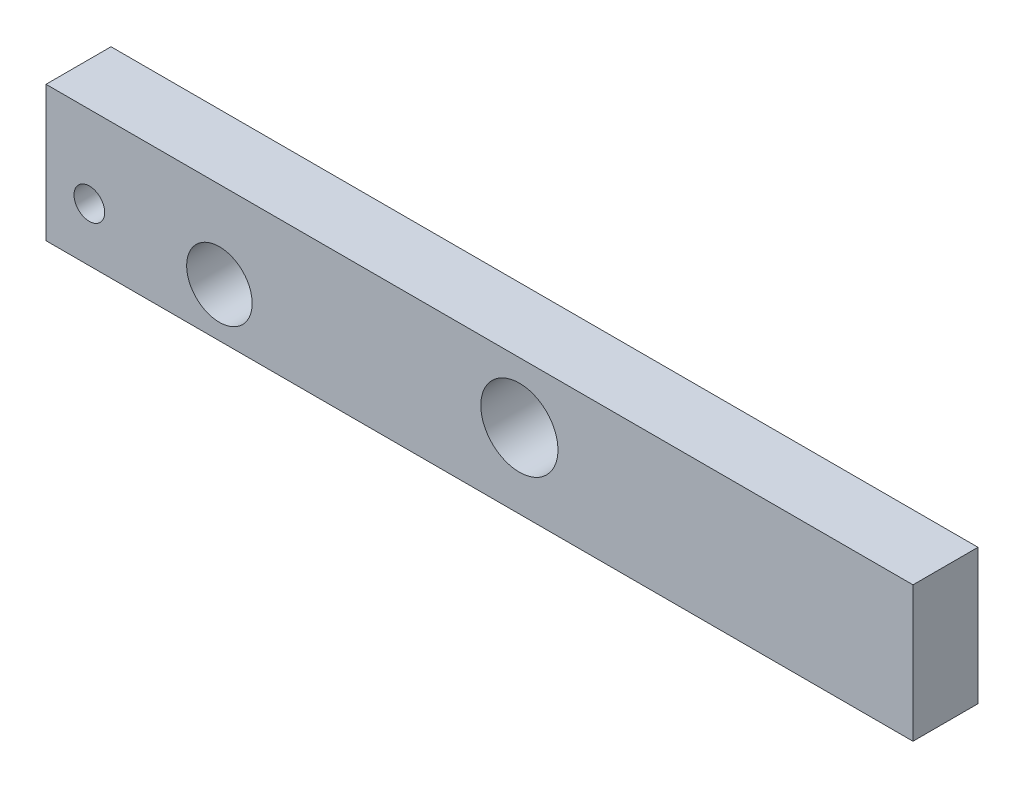
from build123d import *

# Parameters (mm, degrees)
SKETCH1_W           = 127
SKETCH1_H           = 44.45
BOSS_EXTRUDE1_DEPTH = 9.525
SKETCH6_R           = 4.8
CUT_EXTRUDE1_DEPTH  = 68.947967225
SKETCH10_R          = 2.286
CUT_EXTRUDE2_DEPTH  = 3.81
SKETCH13_W          = 127
SKETCH13_H          = 49.203053771
CUT_EXTRUDE3_DEPTH  = 68.947967225
SKETCH15_R          = 5.652121823
CUT_EXTRUDE4_DEPTH  = 68.947967225
SKETCH16_R          = 2.2479
CUT_EXTRUDE5_DEPTH  = 68.947967225


with BuildPart() as part:
    # Sketch1 → Boss-Extrude1 (new body)
    with BuildSketch(Plane.XY):
        Rectangle(SKETCH1_W, SKETCH1_H)
    extrude(amount=BOSS_EXTRUDE1_DEPTH)

    # Sketch6 → Cut-Extrude1 (cut, through all)
    with BuildSketch(Plane.XY):
        with Locations((-38.1, 9.525)):
            Circle(SKETCH6_R)
    extrude(amount=CUT_EXTRUDE1_DEPTH, mode=Mode.SUBTRACT)

    # Sketch10 → Cut-Extrude2 (cut)
    with BuildSketch(Plane.XY.offset(9.525)):
        with Locations((-46.11545283, -16.764)):
            Circle(SKETCH10_R)
    extrude(amount=-CUT_EXTRUDE2_DEPTH, mode=Mode.SUBTRACT)

    # Sketch13 → Cut-Extrude3 (cut, through all)
    with BuildSketch(Plane(origin=(0, 0, 0), x_dir=(-1, 0, 0), z_dir=(0, 0, -1))):
        with Locations((0, -22.225000001)):
            Rectangle(SKETCH13_W, SKETCH13_H)
    extrude(amount=-CUT_EXTRUDE3_DEPTH, mode=Mode.SUBTRACT)

    # Sketch15 → Cut-Extrude4 (cut, through all)
    with BuildSketch(Plane(origin=(0, 0, 0), x_dir=(-1, 0, 0), z_dir=(0, 0, -1))):
        with Locations((-5.842, 13.335)):
            Circle(SKETCH15_R)
    extrude(amount=-CUT_EXTRUDE4_DEPTH, mode=Mode.SUBTRACT)

    # Sketch16 → Cut-Extrude5 (cut, through all)
    with BuildSketch(Plane(origin=(0, 0, 0), x_dir=(-1, 0, 0), z_dir=(0, 0, -1))):
        with Locations((57.15, 10.253019299)):
            Circle(SKETCH16_R)
    extrude(amount=-CUT_EXTRUDE5_DEPTH, mode=Mode.SUBTRACT)


solid = part.part
